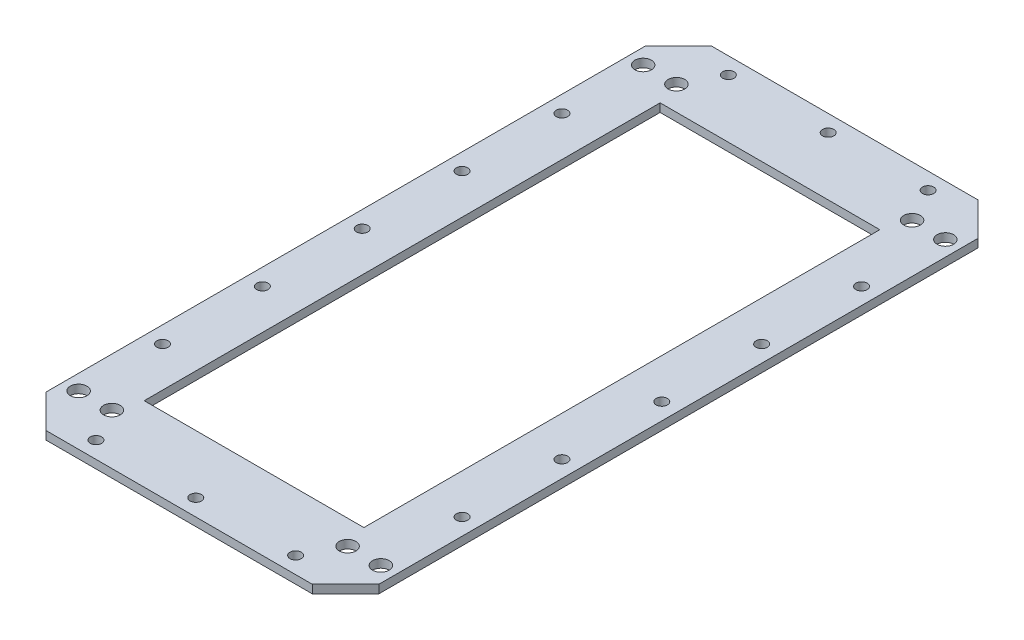
from build123d import *

# Parameters (mm, degrees)
SKETCH2_R           = 2.159
SKETCH2_W           = 83.82
SKETCH2_H           = 196.85
BOSS_EXTRUDE1_DEPTH = 3.175
SKETCH3_R           = 3.175
CUT_EXTRUDE1_DEPTH  = 284.998381377


with BuildPart() as part:
    # Sketch2 → Boss-Extrude1 (new body)
    with BuildSketch(Plane(origin=(0, 0, 0), x_dir=(1, 0, 0), z_dir=(0, 1, 0))):
        Polygon((0, 241.3), (0, 12.7), (12.7, 0), (114.3, 0), (127, 12.7), (127, 241.3), (114.3, 254), (12.7, 254), align=None)
        with Locations((25.4, 6.35)):
            Circle(SKETCH2_R, mode=Mode.SUBTRACT)
        with Locations((6.35, 50.8)):
            Circle(SKETCH2_R, mode=Mode.SUBTRACT)
        with Locations((63.5, 6.35)):
            Circle(SKETCH2_R, mode=Mode.SUBTRACT)
        with Locations((6.35, 88.9)):
            Circle(SKETCH2_R, mode=Mode.SUBTRACT)
        with Locations((101.6, 6.35)):
            Circle(SKETCH2_R, mode=Mode.SUBTRACT)
        with Locations((120.65, 50.8)):
            Circle(SKETCH2_R, mode=Mode.SUBTRACT)
        with Locations((120.65, 88.9)):
            Circle(SKETCH2_R, mode=Mode.SUBTRACT)
        with Locations((6.35, 127)):
            Circle(SKETCH2_R, mode=Mode.SUBTRACT)
        with Locations((6.35, 165.1)):
            Circle(SKETCH2_R, mode=Mode.SUBTRACT)
        with Locations((63.5, 127)):
            Rectangle(SKETCH2_W, SKETCH2_H, mode=Mode.SUBTRACT)
        with Locations((6.35, 203.2)):
            Circle(SKETCH2_R, mode=Mode.SUBTRACT)
        with Locations((25.4, 247.65)):
            Circle(SKETCH2_R, mode=Mode.SUBTRACT)
        with Locations((63.5, 247.65)):
            Circle(SKETCH2_R, mode=Mode.SUBTRACT)
        with Locations((120.65, 127)):
            Circle(SKETCH2_R, mode=Mode.SUBTRACT)
        with Locations((120.65, 165.1)):
            Circle(SKETCH2_R, mode=Mode.SUBTRACT)
        with Locations((120.65, 203.2)):
            Circle(SKETCH2_R, mode=Mode.SUBTRACT)
        with Locations((101.6, 247.65)):
            Circle(SKETCH2_R, mode=Mode.SUBTRACT)
    extrude(amount=BOSS_EXTRUDE1_DEPTH)

    # Sketch3 → Cut-Extrude1 (cut, through all)
    with BuildSketch(Plane(origin=(0, 3.175, 0), x_dir=(1, 0, 0), z_dir=(0, 1, 0))):
        with Locations((5.842, 234.696)):
            Circle(SKETCH3_R)
        with Locations((18.542, 234.696)):
            Circle(SKETCH3_R)
        with Locations((108.458, 234.696)):
            Circle(SKETCH3_R)
        with Locations((121.158, 234.696)):
            Circle(SKETCH3_R)
        with Locations((121.158, 19.304)):
            Circle(SKETCH3_R)
        with Locations((108.458, 19.304)):
            Circle(SKETCH3_R)
        with Locations((18.542, 19.304)):
            Circle(SKETCH3_R)
        with Locations((5.842, 19.304)):
            Circle(SKETCH3_R)
    extrude(amount=-CUT_EXTRUDE1_DEPTH, mode=Mode.SUBTRACT)


solid = part.part
